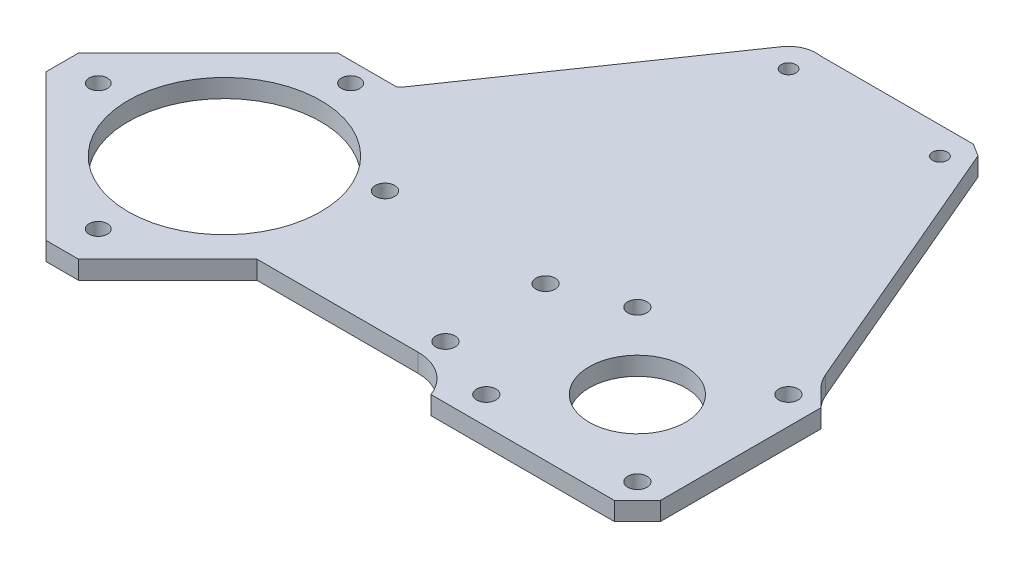
from build123d import *

# Parameters (mm, degrees)
SKETCH_1_R          = 2.1
SKETCH_1_R_2        = 10.5
SKETCH_1_R_3        = 10
EXTRUDE_1_DEPTH     = 4
CHAMFER_1_SIZE      = 5
FILLET_1_R          = 10
SKETCH_2_R          = 2.1
CUT_EXTRUDE_1_DEPTH = 10
EXTRUDE_START       = -4
SKETCH_3_R          = 1.6
EXTRUDE_2_DEPTH     = 4
FILLET_2_R          = 3
FILLET_3_R          = 11
SKETCH_4_R          = 1.6
EXTRUDE_3_DEPTH     = 4
FILLET_4_R          = 10
CHAMFER_2_SIZE      = 2
CHAMFER_2_SIZE2     = 1.851556395
FILLET_5_R          = 10
SKETCH_5_R          = 17.5
CUT_EXTRUDE_2_DEPTH = 10
SKETCH_7_R          = 2.1
EXTRUDE_9_DEPTH     = 4
EXTRUDE_10_DEPTH    = 8
EXTRUDE_11_DEPTH    = 4


with BuildPart() as part:
    # 草图1 → 凸台-拉伸1 (new body)
    with BuildSketch(Plane(origin=(0, 0, 0), x_dir=(1, 0, 0), z_dir=(0, 1, 0))):
        Polygon((0, 31.819805153), (-31.819805153, 0), (0, -31.819805153), (15.909902577, -15.909902577), (67.5, -15.909902577), (67.5, -22.5), (112.5, -22.5), (112.5, 22.5), (67.5, 22.5), (67.5, 15.909902577), (15.909902577, 15.909902577), align=None)
        with Locations(Location((0, 14, 0), (0, 0, 270))):
            Circle(SKETCH_1_R, mode=Mode.SUBTRACT)
        with Locations(Location((14, 0, 0), (0, 0, 270))):
            Circle(SKETCH_1_R, mode=Mode.SUBTRACT)
        with Locations(Location((0, -14, 0), (0, 0, 270))):
            Circle(SKETCH_1_R, mode=Mode.SUBTRACT)
        with Locations(Location((-14, 0, 0), (0, 0, 270))):
            Circle(SKETCH_1_R, mode=Mode.SUBTRACT)
        with Locations(Location((90, 0, 0), (0, 0, 270))):
            Circle(SKETCH_1_R_2, mode=Mode.SUBTRACT)
        with Locations(Location((0, 22.5, 0), (0, 0, 270))):
            Circle(SKETCH_1_R, mode=Mode.SUBTRACT)
        with Locations(Location((0, -22.5, 0), (0, 0, 270))):
            Circle(SKETCH_1_R, mode=Mode.SUBTRACT)
        with Locations(Location((0, 0, 0), (0, 0, 270))):
            Circle(SKETCH_1_R_3, mode=Mode.SUBTRACT)
        with Locations(Location((-22.5, 0, 0), (0, 0, 270))):
            Circle(SKETCH_1_R, mode=Mode.SUBTRACT)
    extrude(amount=EXTRUDE_1_DEPTH)

    # 倒角1
    chamfer_1_edges = [part.edges().sort_by_distance(p)[0] for p in [
        (112.5, 2, -22.5),
        (112.5, 2, 22.5),
        (0, 2, 31.819805153),
        (-31.819805153, 2, 0),
        (0, 2, -31.819805153),
    ]]
    chamfer(chamfer_1_edges, length=CHAMFER_1_SIZE)

    # 圆角1
    # the kernel refuses this fillet: 10 mm, written as the material it adds along each edge
    with BuildSketch(Plane(origin=(15.909902577, 0, -15.909902577), x_dir=(-0.707106781186552, 0, -0.707106781186543), z_dir=(0, 1, 0))) as fillet_1_piece_1:
        with BuildLine():
            CenterArc((FILLET_1_R * 0.414213562373, -FILLET_1_R), FILLET_1_R, 90, 45)
            Line((-FILLET_1_R * 0.292893218813, -FILLET_1_R * 0.292893218813), (-FILLET_1_R * 0.307035354437, -FILLET_1_R * 0.27875108319))
            Line((-FILLET_1_R * 0.307035354437, -FILLET_1_R * 0.27875108319), (-FILLET_1_R * 0.00828427124746, FILLET_1_R * 0.02))
            Line((-FILLET_1_R * 0.00828427124746, FILLET_1_R * 0.02), (FILLET_1_R * 0.414213562373, FILLET_1_R * 0.02))
            Line((FILLET_1_R * 0.414213562373, FILLET_1_R * 0.02), (FILLET_1_R * 0.414213562373, 0))
        make_face()
    extrude(amount=4)
    with BuildSketch(Plane(origin=(15.909902577, 0, 15.909902577), x_dir=(-0.7071067811865422, 0, 0.707106781186553), z_dir=(0, 1, 0))) as fillet_1_piece_2:
        with BuildLine():
            CenterArc((FILLET_1_R * 0.414213562373, FILLET_1_R), FILLET_1_R, 225, 45)
            Line((-FILLET_1_R * 0.292893218813, FILLET_1_R * 0.292893218813), (-FILLET_1_R * 0.307035354437, FILLET_1_R * 0.27875108319))
            Line((-FILLET_1_R * 0.307035354437, FILLET_1_R * 0.27875108319), (-FILLET_1_R * 0.00828427124746, -FILLET_1_R * 0.02))
            Line((-FILLET_1_R * 0.00828427124746, -FILLET_1_R * 0.02), (FILLET_1_R * 0.414213562373, -FILLET_1_R * 0.02))
            Line((FILLET_1_R * 0.414213562373, -FILLET_1_R * 0.02), (FILLET_1_R * 0.414213562373, 0))
        make_face()
    extrude(amount=4)
    with BuildSketch(Plane(origin=(67.5, 0, 15.909902577), x_dir=(-1, 0, 0), z_dir=(0, 1, 0))) as fillet_1_piece_3:
        with BuildLine():
            CenterArc((9.400668296, 10), FILLET_1_R, 199.937217397, 70.062782603)
            Line((0, 6.590097423), (-0.188013366, 6.521899372))
            ThreePointArc((-0.188013366, 6.521899372), (-0.2, 3.295048712), (-0.2, 0))
            Line((-0.2, 0), (0, -0.2))
            Line((0, -0.2), (9.400668296, -0.2))
            Line((9.400668296, -0.2), (9.400668296, 0))
        make_face()
    extrude(amount=4)
    with BuildSketch(Plane(origin=(67.5, 0, -15.909902577), x_dir=(-1, 0, 0), z_dir=(0, 1, 0))) as fillet_1_piece_4:
        with BuildLine():
            CenterArc((9.400668296, -10), FILLET_1_R, 90, 70.062782603)
            Line((0, -6.590097423), (-0.188013366, -6.521899372))
            ThreePointArc((-0.188013366, -6.521899372), (-0.2, -3.295048712), (-0.2, 0))
            Line((-0.2, 0), (0, 0.2))
            Line((0, 0.2), (9.400668296, 0.2))
            Line((9.400668296, 0.2), (9.400668296, 0))
        make_face()
    extrude(amount=4)

    # 草图2 → 切除-拉伸1 (cut)
    with BuildSketch(Plane.XZ):
        with Locations(Location((106.464466094, 16.464466094, 0), (0, 0, 270))):
            Circle(SKETCH_2_R)
        with Locations(Location((106.464466094, -16.464466094, 0), (0, 0, 270))):
            Circle(SKETCH_2_R)
        with Locations(Location((73.535533906, -16.464466094, 0), (0, 0, 90))):
            Circle(SKETCH_2_R)
        with Locations(Location((73.535533906, 16.464466094, 0), (0, 0, 90))):
            Circle(SKETCH_2_R)
        with Locations(Location((24.075684952, 10.909902577, 0), (0, 0, 270))):
            Circle(SKETCH_2_R)
        with Locations(Location((59.075684952, 10.909902577, 0), (0, 0, 270))):
            Circle(SKETCH_2_R)
        with Locations(Location((59.075684952, -10.909902577, 0), (0, 0, 90))):
            Circle(SKETCH_2_R)
        with Locations(Location((24.075684952, -10.909902577, 0), (0, 0, 90))):
            Circle(SKETCH_2_R)
    extrude(amount=-CUT_EXTRUDE_1_DEPTH, mode=Mode.SUBTRACT)

    # 草图3 → 凸台-拉伸2 (add)
    with BuildSketch(Plane(origin=(0, 4, 0), x_dir=(1, 0, 0), z_dir=(0, 1, 0)).offset(EXTRUDE_START)):
        with BuildLine():
            Line((3.535533906, 28.284271247), (40.057636417, 81.344203773))
            ThreePointArc((40.057636417, 81.344203773), (45.94930127, 83.86671265), (50.75784592, 79.629654221))
            Line((50.75784592, 79.629654221), (67.5, 22.5))
            ThreePointArc((67.5, 22.5), (63.839583189, 17.721525883), (58.099331704, 15.909902577))
            Line((58.099331704, 15.909902577), (20.0520382, 15.909902577))
            ThreePointArc((20.0520382, 15.909902577), (16.225203877, 16.671107252), (12.980970389, 18.838834765))
            Line((12.980970389, 18.838834765), (3.535533906, 28.284271247))
        make_face()
        with Locations(Location((45, 77.942286341, 0), (0, 0, 270))):
            Circle(SKETCH_3_R, mode=Mode.SUBTRACT)
        Polygon((16.491758356, 29.470182421), (43.526560522, 68.746803428), (56.080145943, 25.909902577), (20.0520382, 25.909902577), align=None, mode=Mode.SUBTRACT)
    extrude(amount=EXTRUDE_2_DEPTH)

    # 圆角2
    fillet_2_edges = [part.edges().sort_by_distance(p)[0] for p in [
        (16.491758356, 2, -29.470182421),
        (43.526560522, 2, -68.746803428),
        (56.080145943, 2, -25.909902577),
        (20.0520382, 2, -25.909902577),
    ]]
    fillet(fillet_2_edges, radius=FILLET_2_R)

    # 圆角3
    fillet_3_edges = [part.edges().sort_by_distance(p)[0] for p in [
        (67.5, 2, -22.5),
        (3.535533906, 2, -28.284271247),
    ]]
    fillet(fillet_3_edges, radius=FILLET_3_R)

    # 草图4 → 凸台-拉伸3 (add)
    with BuildSketch(Plane(origin=(0, 4, 0), x_dir=(1, 0, 0), z_dir=(0, 1, 0)).offset(EXTRUDE_START)):
        with BuildLine():
            Line((45.94930127, 83.86671265), (81.347717681, 83.86671265))
            Line((81.347717681, 83.86671265), (107.5, 22.5))
            Line((107.5, 22.5), (97.716806526, 22.5))
            Line((97.716806526, 22.5), (75.4, 74.86671265))
            Line((75.4, 74.86671265), (52.153651701, 74.86671265))
            Line((52.153651701, 74.86671265), (50.75784592, 79.629654221))
            ThreePointArc((50.75784592, 79.629654221), (48.966689034, 82.443994695), (45.94930127, 83.86671265))
        make_face()
        with Locations(Location((78, 77.942286341, 0), (0, 0, 270))):
            Circle(SKETCH_4_R, mode=Mode.SUBTRACT)
    extrude(amount=EXTRUDE_3_DEPTH)

    # 圆角4
    fillet_4_edges = [part.edges().sort_by_distance(p)[0] for p in [
        (97.716806526, 2, -22.5),
        (75.4, 2, -74.86671265),
        (52.153651701, 2, -74.86671265),
    ]]
    fillet(fillet_4_edges, radius=FILLET_4_R)

    # 倒角2
    chamfer_2_edges = [part.edges().sort_by_distance(p)[0] for p in [
        (81.347717681, 2, -83.86671265),
    ]]
    chamfer_2_side = [part.faces().sort_by_distance(p)[0] for p in [
        (63.648509476, 2, -83.86671265),
    ]]
    chamfer(chamfer_2_edges, length=CHAMFER_2_SIZE, length2=CHAMFER_2_SIZE2, reference=chamfer_2_side[0])

    # 圆角5
    fillet_5_edges = [part.edges().sort_by_distance(p)[0] for p in [
        (107.5, 2, -22.5),
    ]]
    fillet(fillet_5_edges, radius=FILLET_5_R)

    # 草图5 → 切除-拉伸2 (cut)
    with BuildSketch(Plane(origin=(0, 4, 0), x_dir=(1, 0, 0), z_dir=(0, 1, 0))):
        with Locations(Location((0, 0, 0), (0, 0, 270))):
            Circle(SKETCH_5_R)
    extrude(amount=-CUT_EXTRUDE_2_DEPTH, mode=Mode.SUBTRACT)

    # 草图7 → 凸台-拉伸9 (add)
    with BuildSketch(Plane(origin=(0, 4, 0), x_dir=(1, 0, 0), z_dir=(0, 1, 0)).offset(EXTRUDE_START)):
        with BuildLine():
            ThreePointArc((20.0520382, -15.909902577), (16.225203877, -16.671107252), (12.980970389, -18.838834765))
            Line((12.980970389, -18.838834765), (3.535533906, -28.284271247))
            Line((3.535533906, -28.284271247), (-3.535533906, -28.284271247))
            Line((-3.535533906, -28.284271247), (-28.284271247, -3.535533906))
            Line((-28.284271247, -3.535533906), (-28.284271247, 3.535533906))
            Line((-28.284271247, 3.535533906), (-3.535533906, 28.284271247))
            Line((-3.535533906, 28.284271247), (-2.246903538, 28.284271247))
            ThreePointArc((-2.246903538, 28.284271247), (2.162794465, 29.20684283), (5.832808457, 31.819805153))
            Line((5.832808457, 31.819805153), (-7.071067812, 31.819805153))
            Line((-7.071067812, 31.819805153), (-35.355339059, 3.535533906))
            Line((-35.355339059, 3.535533906), (-35.355339059, -3.535533906))
            Line((-35.355339059, -3.535533906), (-3.535533906, -35.355339059))
            Line((-3.535533906, -35.355339059), (3.535533906, -35.355339059))
            Line((3.535533906, -35.355339059), (22.980970389, -15.909902577))
            Line((22.980970389, -15.909902577), (20.0520382, -15.909902577))
        make_face()
        with Locations((0, -22.5)):
            Circle(SKETCH_7_R)
        with Locations((0, 22.5)):
            Circle(SKETCH_7_R)
        with Locations((-22.5, 0)):
            Circle(SKETCH_7_R)
        with Locations((24.075684952, -10.909902577)):
            Circle(SKETCH_7_R)
    extrude(amount=EXTRUDE_9_DEPTH)


with BuildPart() as body_2:
    # 草图9 → 凸台-拉伸10 (new body)
    with BuildSketch(Plane(origin=(0, 4, 0), x_dir=(1, 0, 0), z_dir=(0, 1, 0))):
        with BuildLine():
            ThreePointArc((2, 27.5), (1.414213562, 28.914213562), (0, 29.5))
            Line((0, 29.5), (0, 25.5))
            ThreePointArc((0, 25.5), (1.414213562, 26.085786438), (2, 27.5))
        make_face()
        with BuildLine():
            Line((0, 25.5), (0, 29.5))
            ThreePointArc((0, 29.5), (-2, 27.5), (0, 25.5))
        make_face()
        with BuildLine():
            ThreePointArc((21, 0), (14.849242405, 14.849242405), (0, 21))
            Line((0, 21), (0, 17.5))
            ThreePointArc((0, 17.5), (12.374368671, 12.374368671), (17.5, 0))
            ThreePointArc((17.5, 0), (12.374368671, -12.374368671), (0, -17.5))
            Line((0, -17.5), (0, -21))
            ThreePointArc((0, -21), (14.849242405, -14.849242405), (21, 0))
        make_face()
        with BuildLine():
            Line((0, 17.5), (0, 21))
            ThreePointArc((0, 21), (-14.849242405, 14.849242405), (-21, 0))
            Line((-21, 0), (-17.5, 0))
            ThreePointArc((-17.5, 0), (-12.374368671, 12.374368671), (0, 17.5))
        make_face()
        with BuildLine():
            Line((-17.5, 0), (-21, 0))
            ThreePointArc((-21, 0), (-14.849242405, -14.849242405), (0, -21))
            Line((0, -21), (0, -17.5))
            ThreePointArc((0, -17.5), (-12.374368671, -12.374368671), (-17.5, 0))
        make_face()
        with BuildLine():
            Line((0, 0), (0, 17.5))
            ThreePointArc((0, 17.5), (-12.374368671, 12.374368671), (-17.5, 0))
            Line((-17.5, 0), (0, 0))
        make_face()
        with BuildLine():
            Line((0, -17.5), (0, 0))
            Line((0, 0), (-17.5, 0))
            ThreePointArc((-17.5, 0), (-12.374368671, -12.374368671), (0, -17.5))
        make_face()
        with BuildLine():
            ThreePointArc((17.5, 0), (12.374368671, 12.374368671), (0, 17.5))
            Line((0, 17.5), (0, 0))
            Line((0, 0), (0, -17.5))
            ThreePointArc((0, -17.5), (12.374368671, -12.374368671), (17.5, 0))
        make_face()
        with BuildLine():
            ThreePointArc((-29.5, 0), (-27.5, -2), (-25.5, 0))
            Line((-25.5, 0), (-29.5, 0))
        make_face()
        with BuildLine():
            Line((-29.5, 0), (-25.5, 0))
            ThreePointArc((-25.5, 0), (-27.5, 2), (-29.5, 0))
        make_face()
        with BuildLine():
            ThreePointArc((2, -27.5), (1.414213562, -26.085786438), (0, -25.5))
            Line((0, -25.5), (0, -29.5))
            ThreePointArc((0, -29.5), (1.414213562, -28.914213562), (2, -27.5))
        make_face()
        with BuildLine():
            Line((0, -29.5), (0, -25.5))
            ThreePointArc((0, -25.5), (-2, -27.5), (0, -29.5))
        make_face()
    extrude(amount=-EXTRUDE_10_DEPTH)


with BuildPart() as part_1:
    add(part.part)

    # Combine 1: cut body 2
    add(body_2.part, mode=Mode.SUBTRACT)

    # 草图10 → 凸台-拉伸11 (add)
    with BuildSketch(Plane(origin=(0, 4, 0), x_dir=(1, 0, 0), z_dir=(0, 1, 0))):
        Polygon((64.860362007, 78.786003649), (37.290552299, 66.389765699), (10.816007298, 26.699675726), (34.20335455, 14.425182396), (66.604419696, 20.562429061), (97.537214988, 20.562429061), (99.113349063, 32.87889421), (78.415005872, 73.577223442), align=None)
    extrude(amount=-EXTRUDE_11_DEPTH)


solid = part_1.part
